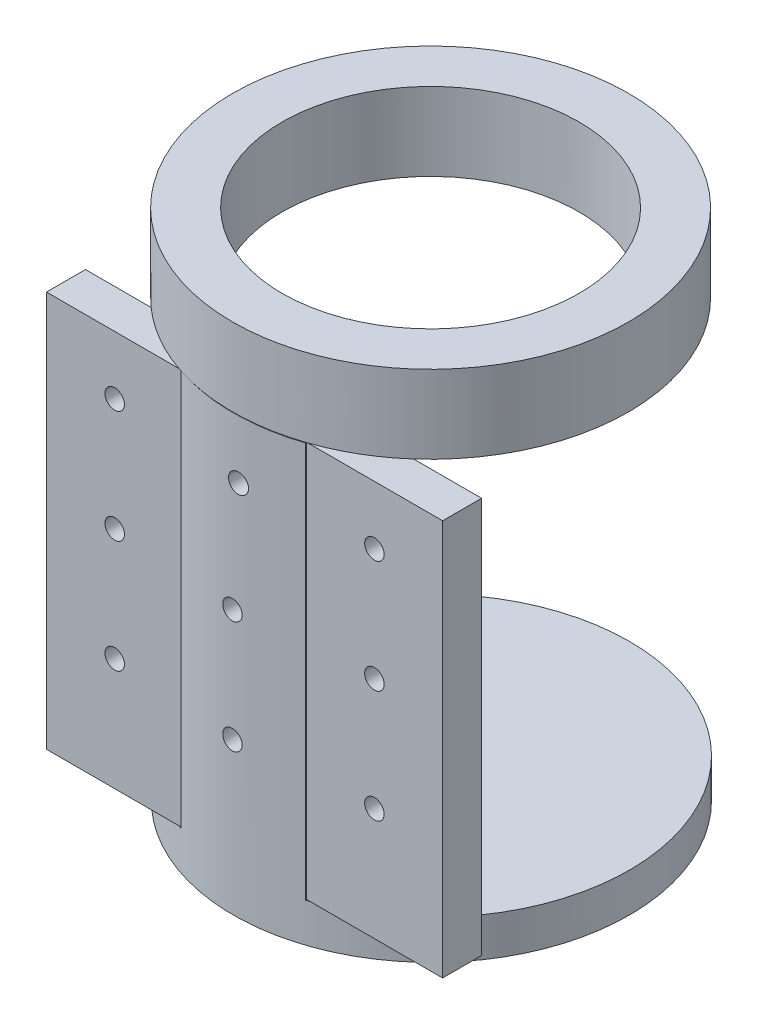
from build123d import *

# Parameters (mm, degrees)
SKETCH1_R               = 50.8
SKETCH1_R_2             = 38.1
BOSS_EXTRUDE1_DEPTH     = 20
SKETCH2_W               = 31.907935637
SKETCH2_H               = 10.300850003
BOSS_EXTRUDE2_DEPTH     = 101.6
BOSS_EXTRUDE3_DEPTH     = 101.6
BOSS_EXTRUDE4_START     = 10
SKETCH4_R               = 50.816877582
BOSS_EXTRUDE4_DEPTH     = 10
SKETCH6_W               = 34.862909764
SKETCH6_H               = 101.6
BOSS_EXTRUDE5_DEPTH     = 10
SKETCH7_W               = 34.862909764
SKETCH7_H               = 101.6
BOSS_EXTRUDE6_DEPTH     = 10
CUT_EXTRUDE1_DEPTH      = 158.584937893
CUT_EXTRUDE1_DEPTH_BACK = 158.584937893
SKETCH8_R               = 2.5
SKETCH10_R              = 5
CUT_EXTRUDE2_DEPTH      = 5.15
CUT_EXTRUDE3_DEPTH      = 158.584937893
CUT_EXTRUDE3_DEPTH_BACK = 158.584937893
SKETCH11_R              = 2.5
SKETCH12_R              = 5
CUT_EXTRUDE4_DEPTH      = 5.15
CUT_EXTRUDE5_DEPTH      = 152.514092231
CUT_EXTRUDE5_DEPTH_BACK = 152.514092231
SKETCH13_R              = 2.5
SKETCH14_R              = 5
CUT_EXTRUDE6_DEPTH      = 5.15


with BuildPart() as part:
    # Sketch1 → Boss-Extrude1 (new body)
    with BuildSketch(Plane(origin=(0, 0, 0), x_dir=(1, 0, 0), z_dir=(0, 1, 0))):
        Circle(SKETCH1_R)
        Circle(SKETCH1_R_2, mode=Mode.SUBTRACT)
    extrude(amount=BOSS_EXTRUDE1_DEPTH)

    # Sketch2 → Boss-Extrude2 (add)
    with BuildSketch(Plane.XZ):
        with Locations((0.29228093, 43.175050308)):
            Rectangle(SKETCH2_W, SKETCH2_H)
    extrude(amount=BOSS_EXTRUDE2_DEPTH)

    # Sketch3 → Boss-Extrude3 (add)
    with BuildSketch(Plane.XZ.offset(101.6)):
        with BuildLine():
            Line((-15.661686888, 48.325475309), (16.246248749, 48.325475309))
            ThreePointArc((16.246248749, 48.325475309), (0.292280931, 50.894804165), (-15.661686888, 48.325475309))
        make_face()
    extrude(amount=-BOSS_EXTRUDE3_DEPTH)

    # Sketch4 → Boss-Extrude4 (add)
    with BuildSketch(Plane.XZ.offset(101.6).offset(BOSS_EXTRUDE4_START)):
        with Locations((0.292280931, 0.077926583)):
            Circle(SKETCH4_R)
    extrude(amount=-BOSS_EXTRUDE4_DEPTH)

    # Sketch6 → Boss-Extrude5 (add)
    with BuildSketch(Plane(origin=(0, 0, 38.024625306), x_dir=(-1, 0, 0), z_dir=(0, 0, -1))):
        with Locations((33.09314177, -50.8)):
            Rectangle(SKETCH6_W, SKETCH6_H)
    extrude(amount=-BOSS_EXTRUDE5_DEPTH)

    # Sketch7 → Boss-Extrude6 (add)
    with BuildSketch(Plane(origin=(0, 0, 38.024625306), x_dir=(-1, 0, 0), z_dir=(0, 0, -1))):
        with Locations((-33.677703631, -50.8)):
            Rectangle(SKETCH7_W, SKETCH7_H)
    extrude(amount=-BOSS_EXTRUDE6_DEPTH)

    # Sketch8 → Cut-Extrude1 (cut, two sides: drawn at the far end of the back side and taken through both)
    with BuildSketch(Plane.XY.offset(48.024625306).offset(-CUT_EXTRUDE1_DEPTH_BACK)):
        with Locations((33.609158513, -15)):
            Circle(SKETCH8_R)
        with Locations((33.609158513, -43.86666666)):
            Circle(SKETCH8_R)
        with Locations((33.609158513, -72.733333333)):
            Circle(SKETCH8_R)
    extrude(amount=CUT_EXTRUDE1_DEPTH + CUT_EXTRUDE1_DEPTH_BACK, mode=Mode.SUBTRACT)

    # Sketch10 → Cut-Extrude2 (cut)
    with BuildSketch(Plane(origin=(0, 0, 38.024625306), x_dir=(-1, 0, 0), z_dir=(0, 0, -1))):
        with Locations((-33.609158513, -15)):
            Circle(SKETCH10_R)
        with Locations((-33.609158513, -43.86666666)):
            Circle(SKETCH10_R)
        with Locations((-33.609158513, -72.733333333)):
            Circle(SKETCH10_R)
    extrude(amount=-CUT_EXTRUDE2_DEPTH, mode=Mode.SUBTRACT)

    # Sketch11 → Cut-Extrude3 (cut, two sides: drawn at the far end of the back side and taken through both)
    with BuildSketch(Plane.XY.offset(48.024625306).offset(-CUT_EXTRUDE3_DEPTH_BACK)):
        with Locations((-33.024596652, -15)):
            Circle(SKETCH11_R)
        with Locations((-33.024596652, -43.866666667)):
            Circle(SKETCH11_R)
        with Locations((-33.024596652, -72.733333333)):
            Circle(SKETCH11_R)
    extrude(amount=CUT_EXTRUDE3_DEPTH + CUT_EXTRUDE3_DEPTH_BACK, mode=Mode.SUBTRACT)

    # Sketch12 → Cut-Extrude4 (cut)
    with BuildSketch(Plane(origin=(0, 0, 38.024625306), x_dir=(-1, 0, 0), z_dir=(0, 0, -1))):
        with Locations((33.024596652, -15)):
            Circle(SKETCH12_R)
        with Locations((33.024596652, -43.866666667)):
            Circle(SKETCH12_R)
        with Locations((33.024596652, -72.733333333)):
            Circle(SKETCH12_R)
    extrude(amount=-CUT_EXTRUDE4_DEPTH, mode=Mode.SUBTRACT)

    # Sketch13 → Cut-Extrude5 (cut, two sides: drawn at the far end of the back side and taken through both)
    with BuildSketch(Plane(origin=(0, 0, 38.024625306), x_dir=(-1, 0, 0), z_dir=(0, 0, -1)).offset(-CUT_EXTRUDE5_DEPTH_BACK)):
        with Locations((-1.549603414, -15)):
            Circle(SKETCH13_R)
        with Locations((0, -43.866666667)):
            Circle(SKETCH13_R)
        with Locations((0, -72.733333333)):
            Circle(SKETCH13_R)
    extrude(amount=CUT_EXTRUDE5_DEPTH + CUT_EXTRUDE5_DEPTH_BACK, mode=Mode.SUBTRACT)

    # Sketch14 → Cut-Extrude6 (cut)
    with BuildSketch(Plane(origin=(0, 0, 38.024625306), x_dir=(-1, 0, 0), z_dir=(0, 0, -1))):
        with Locations((-1.549603414, -15)):
            Circle(SKETCH14_R)
        with Locations((0, -43.866666667)):
            Circle(SKETCH14_R)
        with Locations((0, -72.733333333)):
            Circle(SKETCH14_R)
    extrude(amount=-CUT_EXTRUDE6_DEPTH, mode=Mode.SUBTRACT)


solid = part.part
